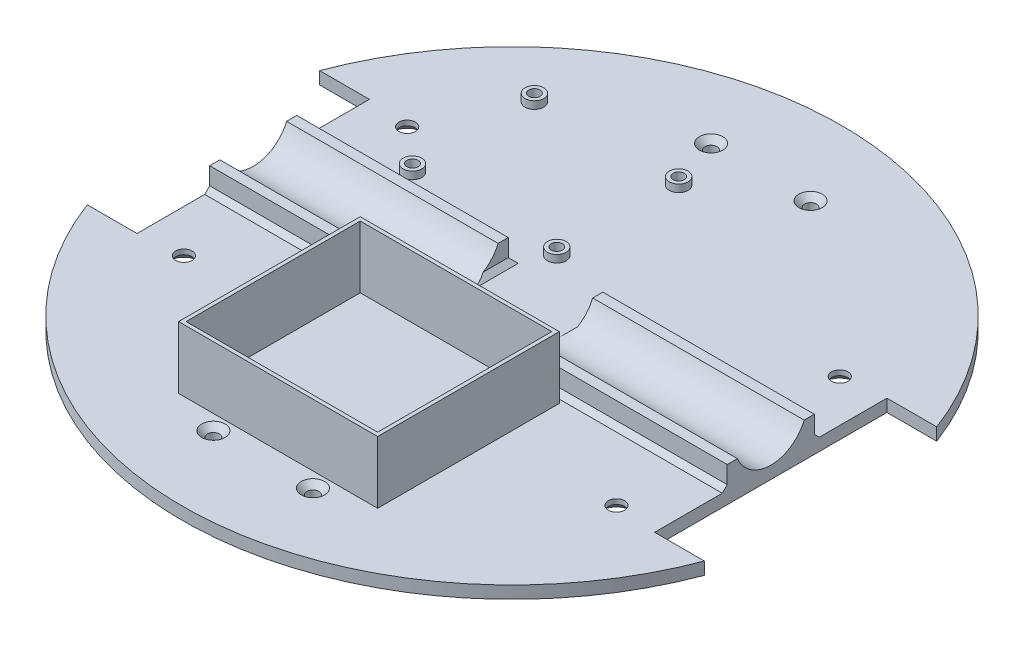
from build123d import *

# Parameters (mm, degrees)
CROQUIS1_R                                           = 132.5
SALIENTE_EXTRUIR1_DEPTH                              = 5
CORTAR_EXTRUIR4_START                                = -5
CORTAR_EXTRUIR4_DEPTH                                = 5
AVELLANADO_PARA_TORNILLO_CON_CABEZA_PLAN_D           = 4.5
AVELLANADO_PARA_TORNILLO_CON_CABEZA_PLAN_CSINK_D     = 9.4
AVELLANADO_PARA_TORNILLO_CON_CABEZA_PLAN_CSINK_ANGLE = 90
AVELLANADO_PARA_TORNILLO_CON_CABEZA_2_D              = 6.6
AVELLANADO_PARA_TORNILLO_CON_CABEZA_2_CSINK_D        = 12.6
AVELLANADO_PARA_TORNILLO_CON_CABEZA_2_CSINK_ANGLE    = 90
AVELLANADO_PARA_TORNILLO_CON_CABEZA_3_D              = 4.8
AVELLANADO_PARA_TORNILLO_CON_CABEZA_3_CSINK_D        = 9.4
AVELLANADO_PARA_TORNILLO_CON_CABEZA_3_CSINK_ANGLE    = 90
CROQUIS32_W                                          = 85
CROQUIS32_H                                          = 35
SALIENTE_EXTRUIR6_DEPTH                              = 14.5
CORTAR_EXTRUIR8_REACH                                = 266.425
CROQUIS33_R                                          = 14.5
CORTAR_EXTRUIR9_START                                = -208
CROQUIS34_W                                          = 35
CROQUIS34_H                                          = 5.5
CORTAR_EXTRUIR9_DEPTH                                = 208
CHAFL_N2_SIZE                                        = 2
CROQUIS35_W                                          = 80
CROQUIS35_H                                          = 73
CROQUIS35_W_2                                        = 77
CROQUIS35_H_2                                        = 70
SALIENTE_EXTRUIR7_DEPTH                              = 25
SALIENTE_EXTRUIR8_START                              = 3
CROQUIS36_R                                          = 3.75
CROQUIS36_R_2                                        = 2.25
SALIENTE_EXTRUIR8_DEPTH                              = 3


with BuildPart() as part:
    # Croquis1 → Saliente-Extruir1 (new body)
    with BuildSketch(Plane(origin=(0, 0, 0), x_dir=(1, 0, 0), z_dir=(0, 1, 0))):
        with Locations(Location((0, 0, 0), (0, 0, 270))):
            Circle(CROQUIS1_R)
    extrude(amount=SALIENTE_EXTRUIR1_DEPTH)

    # Croquis6 → Cortar-Extruir4 (cut)
    with BuildSketch(Plane(origin=(0, 5, 0), x_dir=(1, 0, 0), z_dir=(0, 1, 0)).offset(CORTAR_EXTRUIR4_START)):
        with BuildLine():
            Line((-104, 46.693147249), (-104, -46.693147249))
            Line((-104, -46.693147249), (-124, -46.693147249))
            ThreePointArc((-124, -46.693147249), (-132.5, 0), (-124, 46.693147249))
            Line((-124, 46.693147249), (-104, 46.693147249))
        make_face()
        with BuildLine():
            Line((104, 46.693147249), (104, -46.693147249))
            Line((104, -46.693147249), (124, -46.693147249))
            ThreePointArc((124, -46.693147249), (132.5, 0), (124, 46.693147249))
            Line((124, 46.693147249), (104, 46.693147249))
        make_face()
    extrude(amount=CORTAR_EXTRUIR4_DEPTH, mode=Mode.SUBTRACT)

    # Avellanado para tornillo con cabeza plan (through all)
    with Locations(Plane(origin=(0, 0, 0), x_dir=(-1, 0, 0), z_dir=(0, -1, 0))):
        with Locations((70, 30), (12, 30), (70, 79), (12, 79)):
            CounterSinkHole(AVELLANADO_PARA_TORNILLO_CON_CABEZA_PLAN_D / 2, AVELLANADO_PARA_TORNILLO_CON_CABEZA_PLAN_CSINK_D / 2, counter_sink_angle=AVELLANADO_PARA_TORNILLO_CON_CABEZA_PLAN_CSINK_ANGLE)

    # Avellanado para tornillo con cabeza  2 (through all)
    with Locations(Plane(origin=(87, 0, 45), x_dir=(0, 0, -1), z_dir=(0, -1, 0))):
        with Locations((0, 0), (0, -173.856203002), (89.72135955, -173.856203002), (89.72135955, 0)):
            CounterSinkHole(AVELLANADO_PARA_TORNILLO_CON_CABEZA_2_D / 2, AVELLANADO_PARA_TORNILLO_CON_CABEZA_2_CSINK_D / 2, counter_sink_angle=AVELLANADO_PARA_TORNILLO_CON_CABEZA_2_CSINK_ANGLE)

    # Avellanado para tornillo con cabeza  3 (through all)
    with Locations(Plane(origin=(0, 5, 0), x_dir=(1, 0, 0), z_dir=(0, 1, 0))):
        with Locations((-20, -100), (20, -100), (-20, 100), (20, 100)):
            CounterSinkHole(AVELLANADO_PARA_TORNILLO_CON_CABEZA_3_D / 2, AVELLANADO_PARA_TORNILLO_CON_CABEZA_3_CSINK_D / 2, counter_sink_angle=AVELLANADO_PARA_TORNILLO_CON_CABEZA_3_CSINK_ANGLE)

    # Croquis32 → Saliente-Extruir6 (add)
    with BuildSketch(Plane(origin=(0, 5, 0), x_dir=(1, 0, 0), z_dir=(0, 1, 0))):
        with Locations((61.5, 0)):
            Rectangle(CROQUIS32_W, CROQUIS32_H)
        with Locations((-61.5, 0)):
            Rectangle(CROQUIS32_W, CROQUIS32_H)
    extrude(amount=SALIENTE_EXTRUIR6_DEPTH)

    # Cortar-Extruir8: up to this face of the body (flat: up to its plane)
    cortar_extruir8_end = Plane(part.part.faces().sort_by_distance((104, 7.577960985, 0))[0])
    # Croquis33 → Cortar-Extruir8 (cut, up to the picked face)
    with BuildSketch(Plane.ZY.offset(104), mode=Mode.PRIVATE) as cortar_extruir8_sk1:
        with Locations((0, 19.5)):
            Circle(CROQUIS33_R)
    cortar_extruir8_tool1 = split(extrude(cortar_extruir8_sk1.sketch, amount=-CORTAR_EXTRUIR8_REACH, mode=Mode.PRIVATE), bisect_by=cortar_extruir8_end, keep=Keep.BOTH, mode=Mode.PRIVATE)
    add(cortar_extruir8_tool1.solids().sort_by(Axis((-104, 19.5, 0), (1, 0, 0)))[0], mode=Mode.SUBTRACT)

    # Croquis34 → Cortar-Extruir9 (cut)
    with BuildSketch(Plane.ZY.offset(104).offset(CORTAR_EXTRUIR9_START)):
        with Locations((0, 16.75)):
            Rectangle(CROQUIS34_W, CROQUIS34_H)
    extrude(amount=CORTAR_EXTRUIR9_DEPTH, mode=Mode.SUBTRACT)

    # Chaflán2
    # the kernel refuses this chamfer: 2 mm, written as the material it adds along each edge
    with BuildSketch(Plane(origin=(104, 5, -17.5), x_dir=(0, 0, -1), z_dir=(-1, 0, 0)), Plane(origin=(19, 5, 17.5), x_dir=(0, 0, 1), z_dir=(1, 0, 0))) as chafl_n2_piece_1:
        Polygon((CHAFL_N2_SIZE, 0), (0, -CHAFL_N2_SIZE), (0, 0), align=None)
    extrude(amount=85)
    with BuildSketch(Plane(origin=(19, 5, -17.5), x_dir=(-1, 0, 0), z_dir=(0, 0, 1))) as chafl_n2_piece_2_section:
        Polygon((CHAFL_N2_SIZE, 0), (0, -CHAFL_N2_SIZE), (0, 0), align=None)
    chafl_n2_piece_2 = extrude(amount=17.5, mode=Mode.PRIVATE)
    chafl_n2_piece_2 = chafl_n2_piece_2 - Plane(origin=(19, 19.5, 0), x_dir=(0, 0, 1), z_dir=(-1, 0, 0)) * Cylinder(14.5, 43, mode=Mode.PRIVATE)
    add(chafl_n2_piece_2)
    with BuildSketch(Plane(origin=(-19, 5, 17.5), x_dir=(0, 0, 1), z_dir=(-1, 0, 0)), Plane(origin=(-104, 5, -17.5), x_dir=(0, 0, -1), z_dir=(1, 0, 0))) as chafl_n2_piece_3:
        Polygon((CHAFL_N2_SIZE, 0), (0, CHAFL_N2_SIZE), (0, 0), align=None)
    extrude(amount=85)
    with BuildSketch(Plane(origin=(-19, 5, 0), x_dir=(1, 0, 0), z_dir=(0, 0, 1))) as chafl_n2_piece_4_section:
        Polygon((CHAFL_N2_SIZE, 0), (0, CHAFL_N2_SIZE), (0, 0), align=None)
    chafl_n2_piece_4 = extrude(amount=17.5, mode=Mode.PRIVATE)
    chafl_n2_piece_4 = chafl_n2_piece_4 - Plane(origin=(-19, 19.5, 0), x_dir=(0, 0, 1), z_dir=(-1, 0, 0)) * Cylinder(14.5, 44, mode=Mode.PRIVATE)
    add(chafl_n2_piece_4)
    with BuildSketch(Plane(origin=(-19, 5, -17.5), x_dir=(1, 0, 0), z_dir=(0, 0, 1))) as chafl_n2_piece_5_section:
        Polygon((CHAFL_N2_SIZE, 0), (0, CHAFL_N2_SIZE), (0, 0), align=None)
    chafl_n2_piece_5 = extrude(amount=17.5, mode=Mode.PRIVATE)
    chafl_n2_piece_5 = chafl_n2_piece_5 - Plane(origin=(-19, 19.5, 0), x_dir=(0, 0, 1), z_dir=(-1, 0, 0)) * Cylinder(14.5, 43, mode=Mode.PRIVATE)
    add(chafl_n2_piece_5)
    with BuildSketch(Plane(origin=(19, 5, 0), x_dir=(-1, 0, 0), z_dir=(0, 0, 1))) as chafl_n2_piece_6_section:
        Polygon((CHAFL_N2_SIZE, 0), (0, -CHAFL_N2_SIZE), (0, 0), align=None)
    chafl_n2_piece_6 = extrude(amount=17.5, mode=Mode.PRIVATE)
    chafl_n2_piece_6 = chafl_n2_piece_6 - Plane(origin=(19, 19.5, 0), x_dir=(0, 0, 1), z_dir=(-1, 0, 0)) * Cylinder(14.5, 44, mode=Mode.PRIVATE)
    add(chafl_n2_piece_6)
    with BuildSketch(Plane(origin=(19, 5, -22.643365976), x_dir=(-1, 0, 0), z_dir=(0, 0, 1))) as chafl_n2_piece_7a_section:
        Polygon((CHAFL_N2_SIZE, 0), (0, -CHAFL_N2_SIZE), (0, 0), align=None)
    chafl_n2_piece_7a = extrude(amount=22.643365976, mode=Mode.PRIVATE)
    chafl_n2_piece_7a = split(chafl_n2_piece_7a, bisect_by=Plane(origin=(19, 5, -17.5), z_dir=(0, 0, -1)), keep=Keep.TOP, mode=Mode.PRIVATE)
    with BuildSketch(Plane(origin=(104, 5, -17.5), x_dir=(0, 0, -1), z_dir=(-1, 0, 0))) as chafl_n2_piece_7b_section:
        Polygon((CHAFL_N2_SIZE, 0), (0, -CHAFL_N2_SIZE), (0, 0), align=None)
    chafl_n2_piece_7b = extrude(amount=90.143365976, mode=Mode.PRIVATE)
    chafl_n2_piece_7b = split(chafl_n2_piece_7b, bisect_by=Plane(origin=(19, 5, -17.5), z_dir=(-1, 0, 0)), keep=Keep.TOP, mode=Mode.PRIVATE)
    chafl_n2_piece_7 = chafl_n2_piece_7a & chafl_n2_piece_7b
    add(chafl_n2_piece_7)
    with BuildSketch(Plane(origin=(13.856634024, 5, 17.5), x_dir=(0, 0, 1), z_dir=(1, 0, 0))) as chafl_n2_piece_8a_section:
        Polygon((CHAFL_N2_SIZE, 0), (0, -CHAFL_N2_SIZE), (0, 0), align=None)
    chafl_n2_piece_8a = extrude(amount=90.143365976, mode=Mode.PRIVATE)
    chafl_n2_piece_8a = split(chafl_n2_piece_8a, bisect_by=Plane(origin=(19, 5, 17.5), z_dir=(-1, 0, 0)), keep=Keep.TOP, mode=Mode.PRIVATE)
    with BuildSketch(Plane(origin=(19, 5, 0), x_dir=(-1, 0, 0), z_dir=(0, 0, 1))) as chafl_n2_piece_8b_section:
        Polygon((CHAFL_N2_SIZE, 0), (0, -CHAFL_N2_SIZE), (0, 0), align=None)
    chafl_n2_piece_8b = extrude(amount=22.643365976, mode=Mode.PRIVATE)
    chafl_n2_piece_8b = split(chafl_n2_piece_8b, bisect_by=Plane(origin=(19, 5, 17.5), z_dir=(0, 0, 1)), keep=Keep.TOP, mode=Mode.PRIVATE)
    chafl_n2_piece_8 = chafl_n2_piece_8a & chafl_n2_piece_8b
    add(chafl_n2_piece_8)
    with BuildSketch(Plane(origin=(-13.856634024, 5, 17.5), x_dir=(0, 0, 1), z_dir=(-1, 0, 0))) as chafl_n2_piece_9a_section:
        Polygon((CHAFL_N2_SIZE, 0), (0, CHAFL_N2_SIZE), (0, 0), align=None)
    chafl_n2_piece_9a = extrude(amount=90.143365976, mode=Mode.PRIVATE)
    chafl_n2_piece_9a = split(chafl_n2_piece_9a, bisect_by=Plane(origin=(-19, 5, 17.5), z_dir=(1, 0, 0)), keep=Keep.TOP, mode=Mode.PRIVATE)
    with BuildSketch(Plane(origin=(-19, 5, 0), x_dir=(1, 0, 0), z_dir=(0, 0, 1))) as chafl_n2_piece_9b_section:
        Polygon((CHAFL_N2_SIZE, 0), (0, CHAFL_N2_SIZE), (0, 0), align=None)
    chafl_n2_piece_9b = extrude(amount=22.643365976, mode=Mode.PRIVATE)
    chafl_n2_piece_9b = split(chafl_n2_piece_9b, bisect_by=Plane(origin=(-19, 5, 17.5), z_dir=(0, 0, 1)), keep=Keep.TOP, mode=Mode.PRIVATE)
    chafl_n2_piece_9 = chafl_n2_piece_9a & chafl_n2_piece_9b
    add(chafl_n2_piece_9)
    with BuildSketch(Plane(origin=(-104, 5, -17.5), x_dir=(0, 0, -1), z_dir=(1, 0, 0))) as chafl_n2_piece_10a_section:
        Polygon((CHAFL_N2_SIZE, 0), (0, CHAFL_N2_SIZE), (0, 0), align=None)
    chafl_n2_piece_10a = extrude(amount=90.143365976, mode=Mode.PRIVATE)
    chafl_n2_piece_10a = split(chafl_n2_piece_10a, bisect_by=Plane(origin=(-19, 5, -17.5), z_dir=(1, 0, 0)), keep=Keep.TOP, mode=Mode.PRIVATE)
    with BuildSketch(Plane(origin=(-19, 5, -22.643365976), x_dir=(1, 0, 0), z_dir=(0, 0, 1))) as chafl_n2_piece_10b_section:
        Polygon((CHAFL_N2_SIZE, 0), (0, CHAFL_N2_SIZE), (0, 0), align=None)
    chafl_n2_piece_10b = extrude(amount=22.643365976, mode=Mode.PRIVATE)
    chafl_n2_piece_10b = split(chafl_n2_piece_10b, bisect_by=Plane(origin=(-19, 5, -17.5), z_dir=(0, 0, -1)), keep=Keep.TOP, mode=Mode.PRIVATE)
    chafl_n2_piece_10 = chafl_n2_piece_10a & chafl_n2_piece_10b
    add(chafl_n2_piece_10)

    # Croquis35 → Saliente-Extruir7 (add)
    with BuildSketch(Plane(origin=(0, 5, 0), x_dir=(1, 0, 0), z_dir=(0, 1, 0))):
        with Locations((0, -57.5)):
            Rectangle(CROQUIS35_W, CROQUIS35_H)
        with Locations((0, -57.5)):
            Rectangle(CROQUIS35_W_2, CROQUIS35_H_2, mode=Mode.SUBTRACT)
    extrude(amount=SALIENTE_EXTRUIR7_DEPTH)

    # Croquis36 → Saliente-Extruir8 (add)
    # profile 1 of 4: a face of its own
    with BuildSketch(Plane(origin=(0, 5, 0), x_dir=(1, 0, 0), z_dir=(0, 1, 0)).offset(SALIENTE_EXTRUIR8_START)):
        with Locations(Location((-70, 79, 0), (0, 0, 270))):
            Circle(CROQUIS36_R)
        with Locations(Location((-70, 79, 0), (0, 0, 90))):
            Circle(CROQUIS36_R_2, mode=Mode.SUBTRACT)
    # profile 2 of 4: a face of its own
    with BuildSketch(Plane(origin=(0, 5, 0), x_dir=(1, 0, 0), z_dir=(0, 1, 0)).offset(SALIENTE_EXTRUIR8_START)):
        with Locations(Location((-12, 79, 0), (0, 0, 270))):
            Circle(CROQUIS36_R)
        with Locations(Location((-12, 79, 0), (0, 0, 90))):
            Circle(CROQUIS36_R_2, mode=Mode.SUBTRACT)
    # profile 3 of 4: a face of its own
    with BuildSketch(Plane(origin=(0, 5, 0), x_dir=(1, 0, 0), z_dir=(0, 1, 0)).offset(SALIENTE_EXTRUIR8_START)):
        with Locations(Location((-12, 30, 0), (0, 0, 270))):
            Circle(CROQUIS36_R)
        with Locations(Location((-12, 30, 0), (0, 0, 90))):
            Circle(CROQUIS36_R_2, mode=Mode.SUBTRACT)
    # profile 4 of 4: a face of its own
    with BuildSketch(Plane(origin=(0, 5, 0), x_dir=(1, 0, 0), z_dir=(0, 1, 0)).offset(SALIENTE_EXTRUIR8_START)):
        with Locations(Location((-70, 30, 0), (0, 0, 270))):
            Circle(CROQUIS36_R)
        with Locations(Location((-70, 30, 0), (0, 0, 90))):
            Circle(CROQUIS36_R_2, mode=Mode.SUBTRACT)
    extrude(amount=-SALIENTE_EXTRUIR8_DEPTH)


solid = part.part
